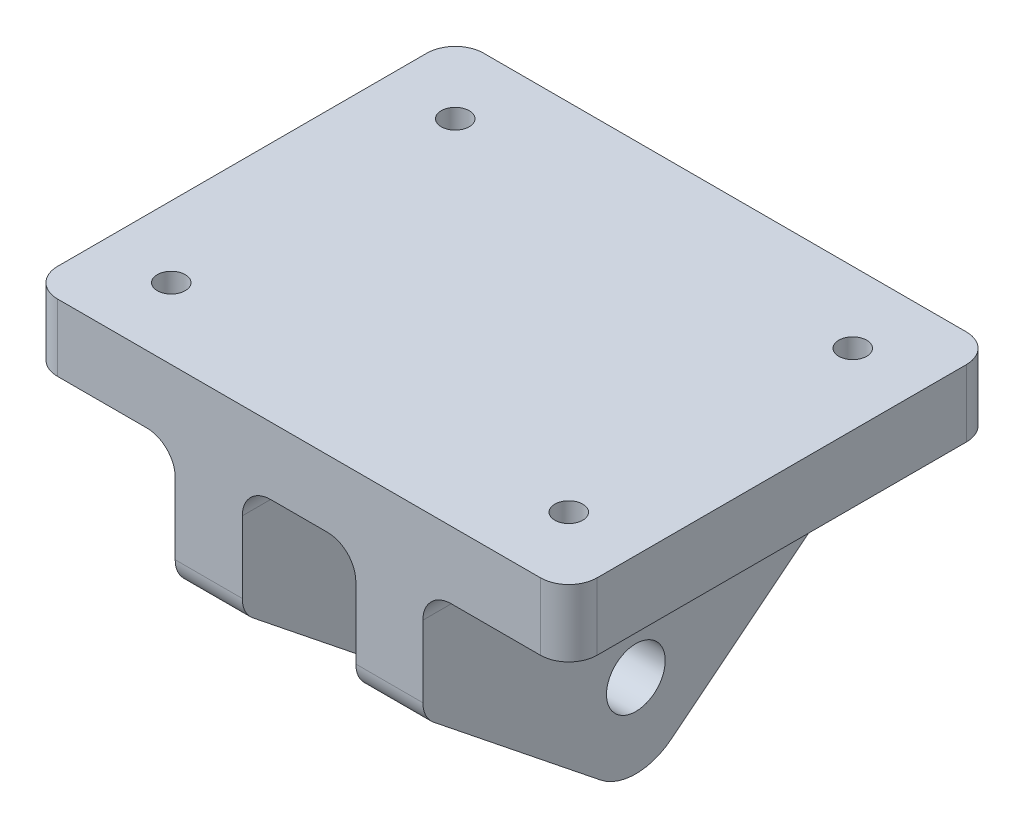
from build123d import *
from OCP.BRepFilletAPI import BRepFilletAPI_MakeFillet

# Parameters (mm, degrees)
SKETCH1_R           = 2.627
BOSS_EXTRUDE1_DEPTH = 6
BOSS_EXTRUDE2_START = -5.08
SKETCH1_3_W         = 38.1
SKETCH1_3_H         = 5.999999938
BOSS_EXTRUDE2_DEPTH = 24.13
SKETCH3_R           = 1.25
CUT_EXTRUDE1_DEPTH  = 44.944503594
FILLET1_R1          = 2.54
FILLET1_R2          = 5.08
SKETCH4_R           = 4.2145
SKETCH4_R_2         = 2.627
BOSS_EXTRUDE3_DEPTH = 2.54
BOSS_EXTRUDE4_START = 7.62
SKETCH4_2_R         = 4.2145
SKETCH4_2_R_2       = 2.627
BOSS_EXTRUDE4_DEPTH = 2.54
CHAMFER2_SIZE       = 2.54


with BuildPart() as part:
    # Sketch1 → Boss-Extrude1 (new body)
    with BuildSketch(Plane(origin=(5.08, 0, 0), x_dir=(0, 0, -1), z_dir=(1, 0, 0))):
        Polygon((-19.05, 0), (-19.05, -10.16), (0, -25.4), (19.05, -10.16), (19.05, 0), align=None)
        with Locations((0, -16.51)):
            Circle(SKETCH1_R, mode=Mode.SUBTRACT)
    boss_extrude1 = extrude(amount=BOSS_EXTRUDE1_DEPTH)

    # Sketch1<3> → Boss-Extrude2 (add)
    with BuildSketch(Plane(origin=(5.08, 0, 0), x_dir=(0, 0, -1), z_dir=(1, 0, 0)).offset(BOSS_EXTRUDE2_START)):
        with Locations((0, 2.999999969)):
            Rectangle(SKETCH1_3_W, SKETCH1_3_H)
    boss_extrude2 = extrude(amount=BOSS_EXTRUDE2_DEPTH)

    # Sketch3 → Cut-Extrude1 (cut, through all)
    with BuildSketch(Plane(origin=(0, 5.999999938, 0), x_dir=(1, 0, 0), z_dir=(0, 1, 0))):
        with Locations(Location((17.78, 12.7, 0), (0, 0, 270))):
            Circle(SKETCH3_R)
        with Locations(Location((17.78, -12.7, 0), (0, 0, 90))):
            Circle(SKETCH3_R)
    cut_extrude1 = extrude(amount=-CUT_EXTRUDE1_DEPTH, mode=Mode.SUBTRACT)

    # Mirror2: Boss-Extrude2, Cut-Extrude1 across plane
    add(boss_extrude2.mirror(Plane(origin=(0, 0, 0), x_dir=(0, 0, 1), z_dir=(1, 0, 0))))
    add(cut_extrude1.mirror(Plane(origin=(0, 0, 0), x_dir=(0, 0, 1), z_dir=(1, 0, 0))), mode=Mode.SUBTRACT)

    # Mirror3: Boss-Extrude1 across plane
    add(boss_extrude1.mirror(Plane(origin=(0, 0, 0), x_dir=(0, 0, 1), z_dir=(1, 0, 0))))

    # Fillet1: one fillet with a radius per group of edges: ONE call of the kernel's fillet builder (fillet() takes one radius for all edges)
    fillet1_edges_1 = [part.edges().sort_by_distance(p)[0] for p in [
        (8.08, -10.16, 19.05),
        (8.08, -10.16, -19.05),
        (11.08, 0, 0),
        (24.13, 2.999999969, 19.05),
        (24.13, 2.999999969, -19.05),
        (-24.13, 2.999999969, -19.05),
        (-24.13, 2.999999969, 19.05),
        (-8.08, -10.16, -19.05),
        (-8.08, -10.16, 19.05),
        (-5.08, 0, 0),
        (-11.08, 0, 0),
        (5.08, 0, 0),
    ]]
    fillet1_edges_2 = [part.edges().sort_by_distance(p)[0] for p in [
        (8.08, -25.4, 0),
        (-8.08, -25.4, 0),
    ]]
    fillet1 = BRepFilletAPI_MakeFillet(part.part.solid().wrapped)
    for e in fillet1_edges_1:
        fillet1.Add(FILLET1_R1, e.wrapped)
    for e in fillet1_edges_2:
        fillet1.Add(FILLET1_R2, e.wrapped)
    add(Compound.cast(fillet1.Shape()), mode=Mode.REPLACE)

    # Sketch4 → Boss-Extrude3 (add)
    with BuildSketch(Plane.ZY.offset(-5.08)):
        with Locations(Location((0, -16.51, 0), (0, 0, 180))):
            Circle(SKETCH4_R)
        with Locations((0, -16.51)):
            Circle(SKETCH4_R_2, mode=Mode.SUBTRACT)
    extrude(amount=BOSS_EXTRUDE3_DEPTH)

    # Sketch4<2> → Boss-Extrude4 (add)
    with BuildSketch(Plane.ZY.offset(-5.08).offset(BOSS_EXTRUDE4_START)):
        with Locations(Location((0, -16.51, 0), (0, 0, 180))):
            Circle(SKETCH4_2_R)
        with Locations((0, -16.51)):
            Circle(SKETCH4_2_R_2, mode=Mode.SUBTRACT)
    extrude(amount=BOSS_EXTRUDE4_DEPTH)

    # Chamfer2
    chamfer2_edges = [part.edges().sort_by_distance(p)[0] for p in [
        (5.08, -16.51, 4.2145),
        (-5.08, -16.51, 4.2145),
    ]]
    chamfer(chamfer2_edges, length=CHAMFER2_SIZE - 0.0001)  # a hair under: the kernel refuses the full size


solid = part.part
